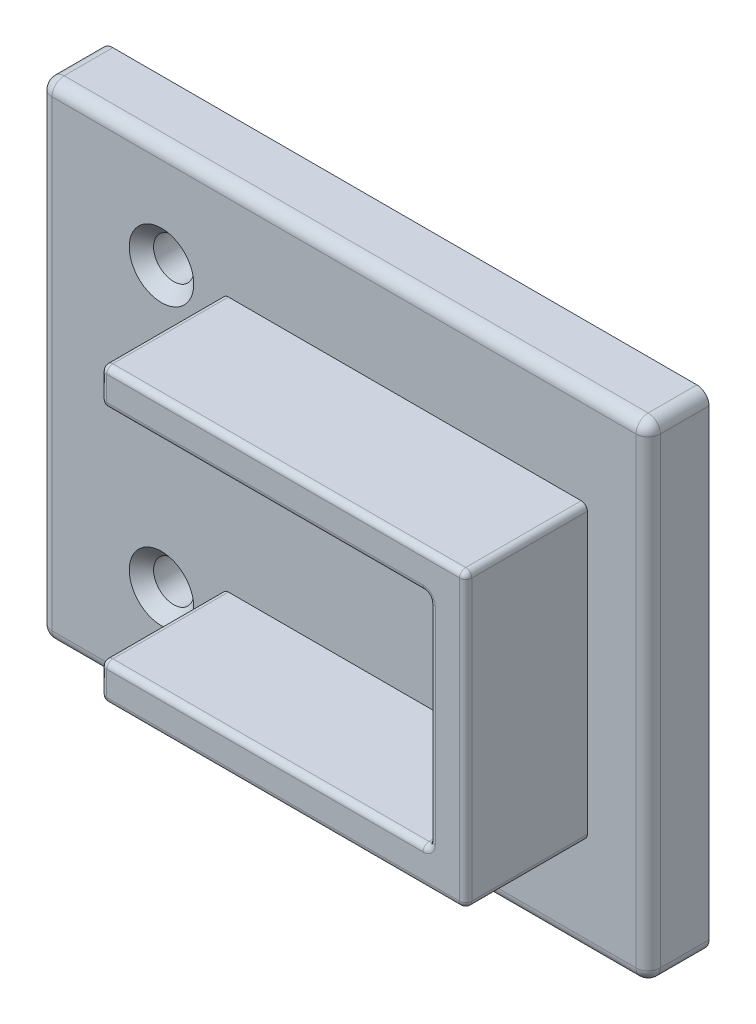
from build123d import *

# Parameters (mm, degrees)
SKETCH_2_W          = 50
SKETCH_2_H          = 40
EXTRUDE_1_DEPTH     = 5
EXTRUDE_START       = -8
SKETCH_5_W          = 30
SKETCH_5_H          = 10
EXTRUDE_2_DEPTH     = 3
SKETCH_6_W          = 30
SKETCH_6_H          = 10
EXTRUDE_3_DEPTH     = 3
CUT_EXTRUDE_1_REACH = 37.355
SKETCH_7_R          = 1.65
FILLET_3_R          = 1
SKETCH_8_W          = 10
SKETCH_8_H          = 21
EXTRUDE_4_DEPTH     = 3
FILLET_4_R          = 0.5
CHAMFER_1_SIZE      = 1


with BuildPart() as part:
    # 草图2 → 凸台-拉伸1 (new body)
    with BuildSketch(Plane.XY):
        Rectangle(SKETCH_2_W, SKETCH_2_H)
    extrude(amount=EXTRUDE_1_DEPTH)

    # 草图5 → 凸台-拉伸2 (add)
    with BuildSketch(Plane.XZ.offset(20).offset(EXTRUDE_START)):
        with Locations((5, 10)):
            Rectangle(SKETCH_5_W, SKETCH_5_H)
    extrude(amount=-EXTRUDE_2_DEPTH)

    # 草图6 → 凸台-拉伸3 (add)
    with BuildSketch(Plane(origin=(0, 20, 0), x_dir=(1, 0, 0), z_dir=(0, 1, 0)).offset(EXTRUDE_START)):
        with Locations((5, -10)):
            Rectangle(SKETCH_6_W, SKETCH_6_H)
    extrude(amount=-EXTRUDE_3_DEPTH)

    # 草图7 → 切除-拉伸1 (cut, up to next)
    with BuildSketch(Plane(origin=(0, 0, 0), x_dir=(-1, 0, 0), z_dir=(0, 0, -1)), mode=Mode.PRIVATE) as cut_extrude_1_sk1:
        with Locations((-10, 0)):
            Circle(SKETCH_7_R)
    cut_extrude_1_tool1 = extrude(cut_extrude_1_sk1.sketch, amount=-CUT_EXTRUDE_1_REACH, mode=Mode.PRIVATE) & part.part
    # 草图7 → 切除-拉伸1 (cut, up to next)
    with BuildSketch(Plane(origin=(0, 0, 0), x_dir=(-1, 0, 0), z_dir=(0, 0, -1)), mode=Mode.PRIVATE) as cut_extrude_1_sk2:
        with Locations((15, -11.5)):
            Circle(SKETCH_7_R)
    cut_extrude_1_tool2 = extrude(cut_extrude_1_sk2.sketch, amount=-CUT_EXTRUDE_1_REACH, mode=Mode.PRIVATE) & part.part
    # 草图7 → 切除-拉伸1 (cut, up to next)
    with BuildSketch(Plane(origin=(0, 0, 0), x_dir=(-1, 0, 0), z_dir=(0, 0, -1)), mode=Mode.PRIVATE) as cut_extrude_1_sk3:
        with Locations((15, 11.5)):
            Circle(SKETCH_7_R)
    cut_extrude_1_tool3 = extrude(cut_extrude_1_sk3.sketch, amount=-CUT_EXTRUDE_1_REACH, mode=Mode.PRIVATE) & part.part
    add(cut_extrude_1_tool1.solids().sort_by_distance((10, 0, 0))[0], mode=Mode.SUBTRACT)
    add(cut_extrude_1_tool2.solids().sort_by_distance((-15, -11.5, 0))[0], mode=Mode.SUBTRACT)
    add(cut_extrude_1_tool3.solids().sort_by_distance((-15, 11.5, 0))[0], mode=Mode.SUBTRACT)

    # 圆角3
    fillet_3_edges = [part.edges().sort_by_distance(p)[0] for p in [
        (0, -20, 5),
        (-25, 0, 5),
        (0, 20, 5),
        (25, 0, 5),
        (-25, -20, 2.5),
        (-25, 20, 2.5),
        (25, 20, 2.5),
        (25, -20, 2.5),
    ]]
    fillet(fillet_3_edges, radius=FILLET_3_R)

    # 草图8 → 凸台-拉伸4 (add)
    with BuildSketch(Plane(origin=(20, 0, 0), x_dir=(0, 0, -1), z_dir=(1, 0, 0))):
        with Locations((-10, -1.5)):
            Rectangle(SKETCH_8_W, SKETCH_8_H)
    extrude(amount=-EXTRUDE_4_DEPTH)

    # 圆角4
    fillet_4_edges = [part.edges().sort_by_distance(p)[0] for p in [
        (3.5, 9, 15),
        (-10, 10.5, 15),
        (5, 12, 15),
        (20, 0, 15),
        (5, -12, 15),
        (-10, -10.5, 15),
        (3.5, -9, 15),
        (17, 0, 15),
        (17, -9, 10),
        (-10, -9, 10),
        (-10, -12, 10),
        (20, 12, 10),
        (-10, 12, 10),
        (-10, 9, 10),
        (17, 9, 10),
        (20, -12, 10),
    ]]
    fillet(fillet_4_edges, radius=FILLET_4_R)

    # 倒角1
    chamfer_1_edges = [part.edges().sort_by_distance(p)[0] for p in [
        (-13.35, 11.5, 5),
        (-13.35, 11.5, 0),
        (-13.35, -11.5, 5),
        (-13.35, -11.5, 0),
        (11.65, 0, 5),
        (11.65, 0, 0),
    ]]
    chamfer(chamfer_1_edges, length=CHAMFER_1_SIZE)


solid = part.part
